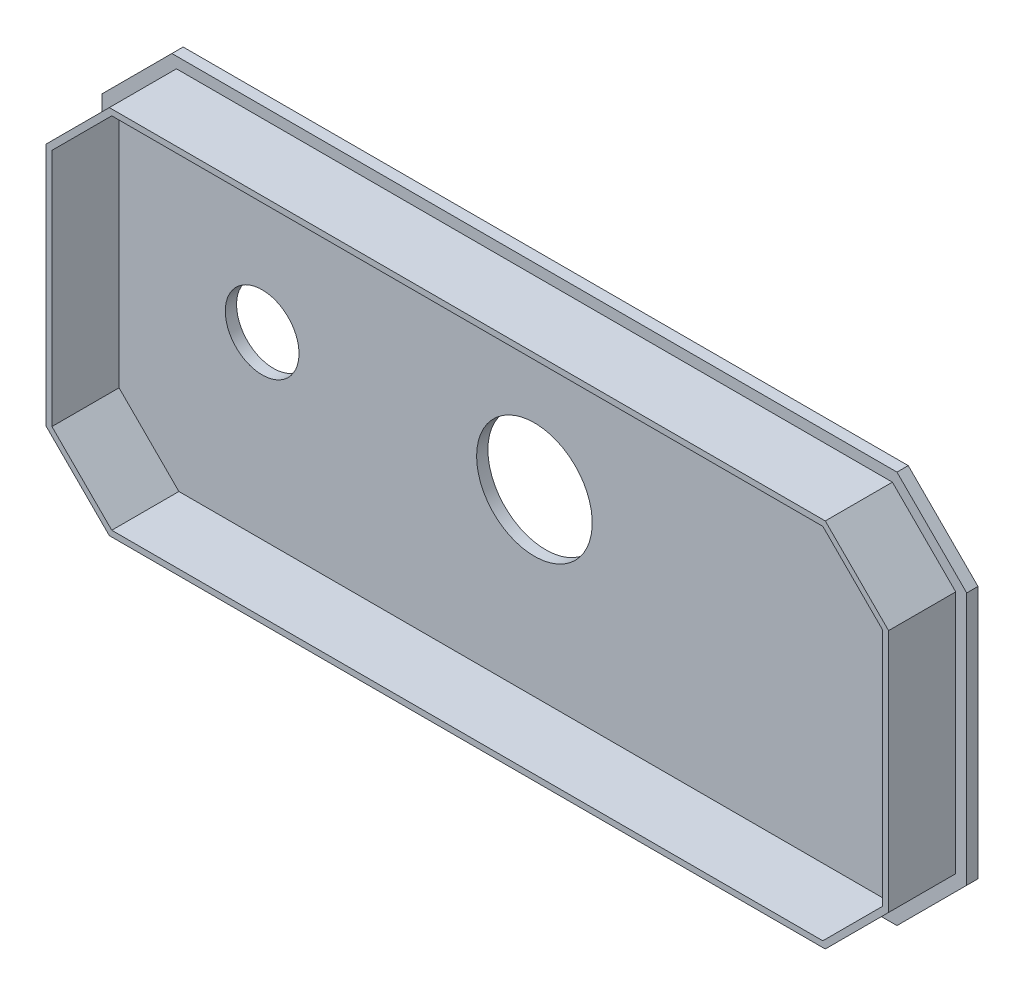
from build123d import *

# Parameters (mm, degrees)
SKETCH1_W           = 61.340800102
SKETCH1_H           = 27.863600102
BOSS_EXTRUDE1_DEPTH = 0.8
CUT_EXTRUDE1_DEPTH  = 34.695823064
BOSS_EXTRUDE2_DEPTH = 4.7625
SKETCH4_R           = 2.6162
CUT_EXTRUDE2_DEPTH  = 2.54
SKETCH5_R           = 4.1021
CUT_EXTRUDE3_DEPTH  = 2.54


with BuildPart() as part:
    # Sketch1 → Boss-Extrude1 (new body)
    with BuildSketch(Plane.XY):
        Rectangle(SKETCH1_W, SKETCH1_H)
    extrude(amount=BOSS_EXTRUDE1_DEPTH)

    # Sketch2 → Cut-Extrude1 (cut, through all)
    with BuildSketch(Plane.XY.offset(0.8)):
        Polygon((-30.670400051, -8.982052583), (-25.720652583, -13.931800051), (-30.670400051, -13.931800051), align=None)
        Polygon((-30.670400051, 8.982052583), (-25.720652583, 13.931800051), (-30.670400051, 13.931800051), align=None)
        Polygon((25.720652583, -13.931800051), (30.670400051, -8.982052583), (30.670400051, -13.931800051), align=None)
        Polygon((25.720652583, 13.931800051), (30.670400051, 8.982052583), (30.670400051, 13.931800051), align=None)
    extrude(amount=-CUT_EXTRUDE1_DEPTH, mode=Mode.SUBTRACT)

    # Sketch3 → Boss-Extrude2 (add)
    with BuildSketch(Plane.XY.offset(0.8)):
        Polygon((25.397566036, 13.151800127), (-25.397566036, 13.151800127), (-29.890400127, 8.658966036), (-29.890400127, -8.658966036), (-25.397566036, -13.151800127), (25.397566036, -13.151800127), (29.890400127, -8.658966036), (29.890400127, 8.658966036), align=None)
        Polygon((-25.223596339, 12.731800127), (-29.470400127, 8.484996339), (-29.470400127, -8.484996339), (-25.223596339, -12.731800127), (25.223596339, -12.731800127), (29.470400127, -8.484996339), (29.470400127, 8.484996339), (25.223596339, 12.731800127), align=None, mode=Mode.SUBTRACT)
    extrude(amount=BOSS_EXTRUDE2_DEPTH)

    # Sketch4 → Cut-Extrude2 (cut)
    with BuildSketch(Plane(origin=(0, 0, 0), x_dir=(-1, 0, 0), z_dir=(0, 0, -1))):
        with Locations((19.316600051, 0)):
            Circle(SKETCH4_R)
    extrude(amount=-CUT_EXTRUDE2_DEPTH, mode=Mode.SUBTRACT)

    # Sketch5 → Cut-Extrude3 (cut)
    with BuildSketch(Plane(origin=(0, 0, 0), x_dir=(-1, 0, 0), z_dir=(0, 0, -1))):
        Circle(SKETCH5_R)
    extrude(amount=-CUT_EXTRUDE3_DEPTH, mode=Mode.SUBTRACT)


solid = part.part
